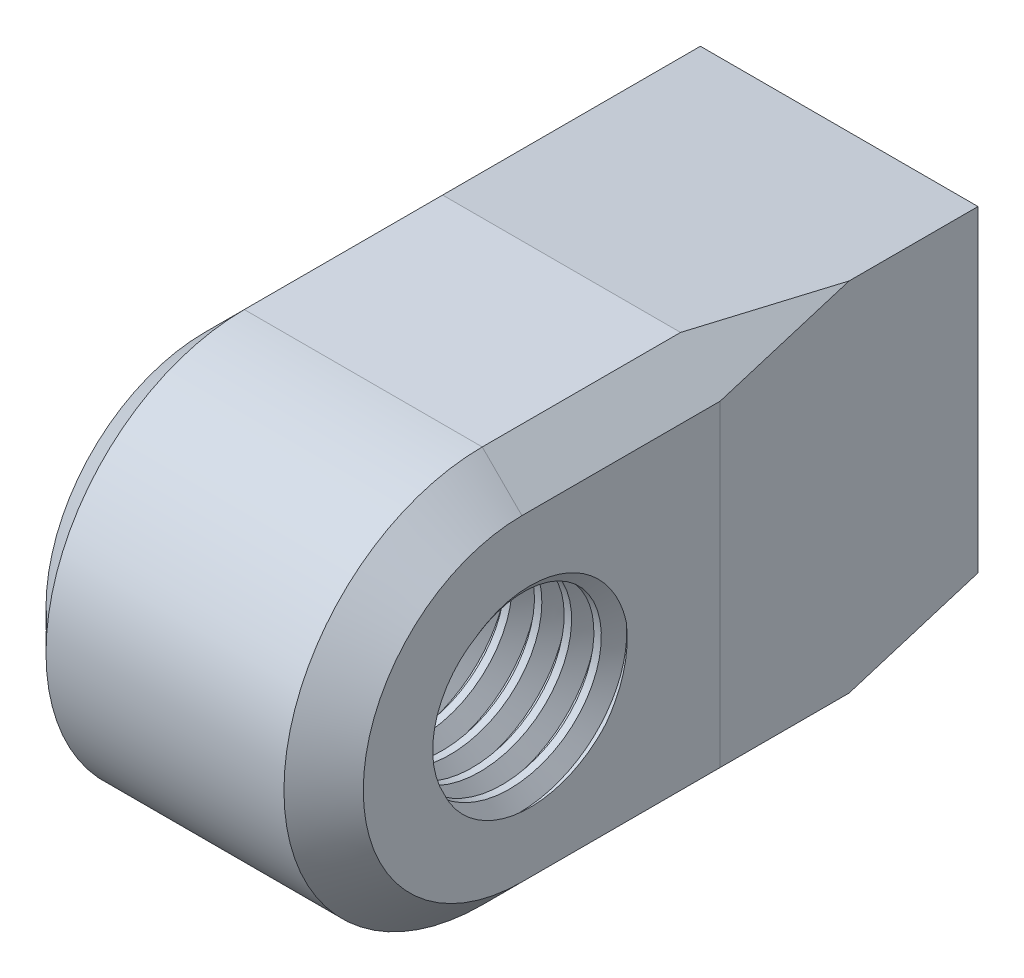
from build123d import *
from OCP.BRepFilletAPI import BRepFilletAPI_MakeChamfer

# Parameters (mm, degrees)
BOSS_EXTRUDE1_DEPTH     = 16
CHAMFER1_SIZE           = 15
CHAMFER1_SIZE2          = 2
SKETCH2_R               = 3
CUT_EXTRUDE1_DEPTH      = 15
CHAMFER2_SIZE           = 2
THREAD1_PITCH           = 1.5
CUT_EXTRUDE2_REACH      = 33.321
CUT_EXTRUDE2_END_RADIUS = 3
SKETCH3_R               = 2.25


with BuildPart() as part:
    # Sketch1 → Boss-Extrude1 (new body)
    with BuildSketch(Plane(origin=(0, 0, 0), x_dir=(0, -1, 0), z_dir=(1, 0, 0))):
        with BuildLine():
            ThreePointArc((-10, 0), (0, 10), (10, 0))
            Line((10, 0), (10, 25))
            Line((10, 25), (-10, 25))
            Line((-10, 25), (-10, 0))
        make_face()
        with BuildLine():
            ThreePointArc((-4.5, 0), (0, 4.5), (4.5, 0))
            Line((4.5, 0), (10, 0))
            ThreePointArc((10, 0), (0, 10), (-10, 0))
            Line((-10, 0), (-4.5, 0))
        make_face()
        with BuildLine():
            Line((10, 0), (4.5, 0))
            ThreePointArc((4.5, 0), (0, -4.5), (-4.5, 0))
            Line((-4.5, 0), (-10, 0))
            ThreePointArc((-10, 0), (0, -10), (10, 0))
        make_face()
    extrude(amount=BOSS_EXTRUDE1_DEPTH)

    # Chamfer1: one chamfer whose edges measure the first distance from different faces: ONE call of the kernel's chamfer builder (chamfer() names one face for all edges)
    chamfer1_edges_1 = [part.edges().sort_by_distance(p)[0] for p in [
        (8, 10, -25),
    ]]
    chamfer1_side_1 = [part.faces().sort_by_distance(p)[0] for p in [
        (8, 10, -12.5),
    ]]
    chamfer1_edges_2 = [part.edges().sort_by_distance(p)[0] for p in [
        (8, -10, -25),
    ]]
    chamfer1_side_2 = [part.faces().sort_by_distance(p)[0] for p in [
        (8, -10, -12.5),
    ]]
    chamfer1_edges_3 = [part.edges().sort_by_distance(p)[0] for p in [
        (16, 0, -25),
    ]]
    chamfer1_side_3 = [part.faces().sort_by_distance(p)[0] for p in [
        (16, 0, -9.408066135),
    ]]
    chamfer1 = BRepFilletAPI_MakeChamfer(part.part.solid().wrapped)
    for e in chamfer1_edges_1:
        chamfer1.Add(CHAMFER1_SIZE, CHAMFER1_SIZE2, e.wrapped, chamfer1_side_1[0].wrapped)  # the first distance lies on this face
    for e in chamfer1_edges_2:
        chamfer1.Add(CHAMFER1_SIZE, CHAMFER1_SIZE2, e.wrapped, chamfer1_side_2[0].wrapped)  # the first distance lies on this face
    for e in chamfer1_edges_3:
        chamfer1.Add(CHAMFER1_SIZE, CHAMFER1_SIZE2, e.wrapped, chamfer1_side_3[0].wrapped)  # the first distance lies on this face
    add(Compound.cast(chamfer1.Shape()), mode=Mode.REPLACE)

    # Sketch2 → Cut-Extrude1 (cut)
    with BuildSketch(Plane(origin=(0, 0, -25), x_dir=(-1, 0, 0), z_dir=(0, 0, -1))):
        with Locations((-8, 0)):
            Circle(SKETCH2_R)
    extrude(amount=-CUT_EXTRUDE1_DEPTH, mode=Mode.SUBTRACT)

    # Chamfer2
    chamfer2_edges = [part.edges().sort_by_distance(p)[0] for p in [
        (0, 0, 10),
        (16, 0, 10),
        (16, 10, -5),
        (0, 10, -5),
        (0, -10, -5),
        (16, -10, -5),
    ]]
    chamfer(chamfer2_edges, length=CHAMFER2_SIZE)

    # Thread1: the profile of Thread Profile1 profile screwed along a right-hand helix of 11.333333 turns, 8 arcs to a turn; built about Z, then put on its axis
    thread1_z = Axis((0, 0, 0), (0, 0, 1))
    thread1_corners = [(4.4997, 0, -0.000173205), (5.311898812, 0, 0.468749998), (5.311898812, 0, 0.656249998), (4.4997, 0, 1.125173201)]
    with BuildLine(mode=Mode.PRIVATE) as thread1_profile:
        Line(thread1_corners[0], thread1_corners[1])
        Line(thread1_corners[1], thread1_corners[2])
        Line(thread1_corners[2], thread1_corners[3])
        Line(thread1_corners[3], thread1_corners[0])
    thread1_cap = Face(thread1_profile.wire())
    thread1_turn_angles = [0, 22.5, 45, 67.5, 90, 112.5, 135, 157.5, 180, 202.5, 225, 247.5, 270, 292.5, 315, 337.5, 360]
    thread1_turn_weights = [1, 0.9238795325112867, 1, 0.9238795325112867, 1, 0.9238795325112867, 1, 0.9238795325112867, 1, 0.9238795325112867, 1, 0.9238795325112867, 1, 0.9238795325112867, 1, 0.9238795325112867, 1]
    thread1_turn_rails = [Edge.make_bspline([Vector(p[0], p[1], 0).rotate(thread1_z, thread1_turn_angles[k]) / thread1_turn_weights[k] + Vector(0, 0, p[2] + THREAD1_PITCH * thread1_turn_angles[k] / 360) for k in range(17)], [0, 0, 0, 1, 1, 2, 2, 3, 3, 4, 4, 5, 5, 6, 6, 7, 7, 8, 8, 8], 2, thread1_turn_weights) for p in thread1_corners]
    thread1_turn_sides = [Face.make_surface_from_curves(thread1_turn_rails[p[0]], thread1_turn_rails[p[1]]) for p in [(0, 1), (1, 2), (2, 3), (3, 0)]]
    thread1_last_angles = [3960, 3982.5, 4005, 4027.5, 4050, 4065, 4080]
    thread1_last_weights = [1, 0.9238795325112867, 1, 0.9238795325112867, 1, 0.9659258262890693, 1]
    thread1_last_rails = [Edge.make_bspline([Vector(p[0], p[1], 0).rotate(thread1_z, thread1_last_angles[k]) / thread1_last_weights[k] + Vector(0, 0, p[2] + THREAD1_PITCH * thread1_last_angles[k] / 360) for k in range(7)], [0, 0, 0, 1, 1, 2, 2, 3, 3, 3], 2, thread1_last_weights) for p in thread1_corners]
    thread1_last_sides = [Face.make_surface_from_curves(thread1_last_rails[p[0]], thread1_last_rails[p[1]]) for p in [(0, 1), (1, 2), (2, 3), (3, 0)]]
    thread1 = Plane(origin=(-1, 0, 0), x_dir=(0, 0, -1), z_dir=(1, 0, 0)) * Solid(Shell([*[p.moved(Location((0, 0, THREAD1_PITCH * i))) for i in range(11) for p in thread1_turn_sides], *thread1_last_sides, thread1_cap, thread1_cap.rotate(thread1_z, 4080).moved(Location((0, 0, THREAD1_PITCH * 4080 / 360)))]))
    add(thread1, mode=Mode.SUBTRACT)

    # Cut-Extrude2: up to this cylinder (the profile starts outside it)
    cut_extrude2_end = Plane(origin=(8, 0, -18), z_dir=(0, 0, -1)) * Cylinder(CUT_EXTRUDE2_END_RADIUS, 73.642, mode=Mode.PRIVATE)
    # Sketch3 → Cut-Extrude2 (cut, up to the surface)
    with BuildSketch(Plane(origin=(0, 0, 0), x_dir=(0, -1, 0), z_dir=(-1, 0, 0)), mode=Mode.PRIVATE) as cut_extrude2_sk1:
        with Locations((0.426638198, -18)):
            Circle(SKETCH3_R)
    cut_extrude2_tool1 = extrude(cut_extrude2_sk1.sketch, amount=-CUT_EXTRUDE2_REACH, mode=Mode.PRIVATE) - cut_extrude2_end
    add(cut_extrude2_tool1.solids().sort_by_distance((0, -0.426638, -18))[0], mode=Mode.SUBTRACT)


solid = part.part
